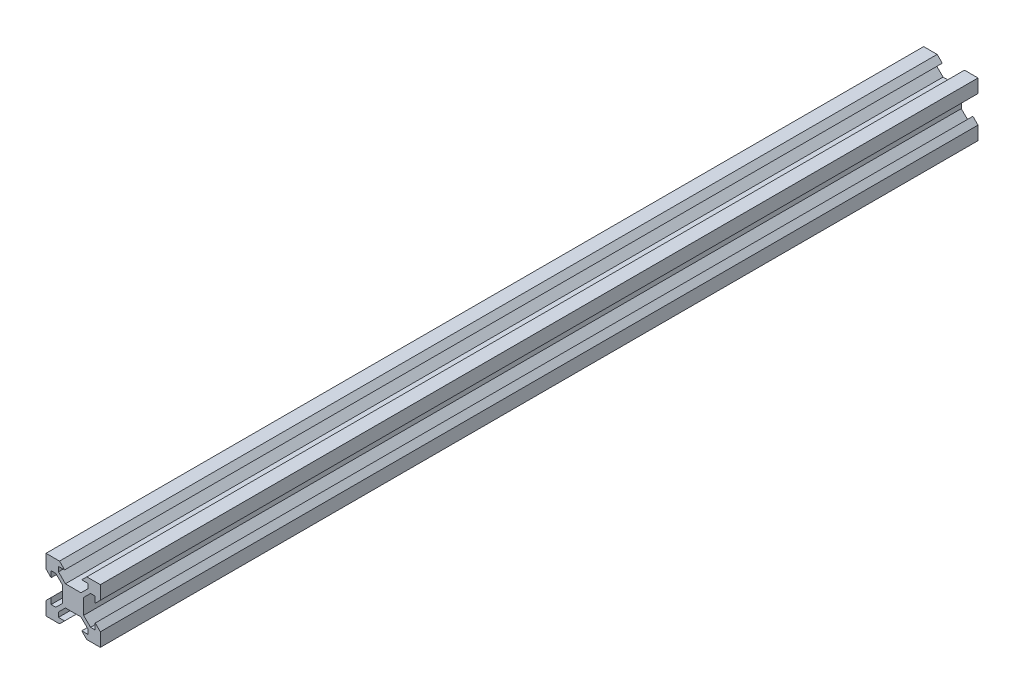
from build123d import *

# Parameters (mm, degrees)
BOSS_EXTRUDE1_DEPTH = 323


with BuildPart() as part:
    # Sketch1 → Boss-Extrude1 (new body)
    with BuildSketch(Plane.XY):
        Polygon((-2.860050506, 3.85), (2.860050506, 3.85), (5.4, 6.389949494), (5.4, 8.125), (3.15, 8.125), (5.025, 10), (10, 10), (10, 5.025), (8.125, 3.15), (8.125, 5.4), (6.389949494, 5.4), (3.85, 2.860050506), (3.85, -2.860050506), (6.389949494, -5.4), (8.125, -5.4), (8.125, -3.15), (10, -5.025), (10, -10), (5.025, -10), (3.15, -8.125), (5.4, -8.125), (5.4, -6.389949494), (2.860050506, -3.85), (-2.860050506, -3.85), (-5.4, -6.389949494), (-5.4, -8.125), (-3.15, -8.125), (-5.025, -10), (-10, -10), (-10, -5.025), (-8.125, -3.15), (-8.125, -5.4), (-6.389949494, -5.4), (-3.85, -2.860050506), (-3.85, 2.860050506), (-6.389949494, 5.4), (-8.125, 5.4), (-8.125, 3.15), (-10, 5.025), (-10, 10), (-5.025, 10), (-3.15, 8.125), (-5.4, 8.125), (-5.4, 6.389949494), align=None)
    extrude(amount=-BOSS_EXTRUDE1_DEPTH)


solid = part.part
